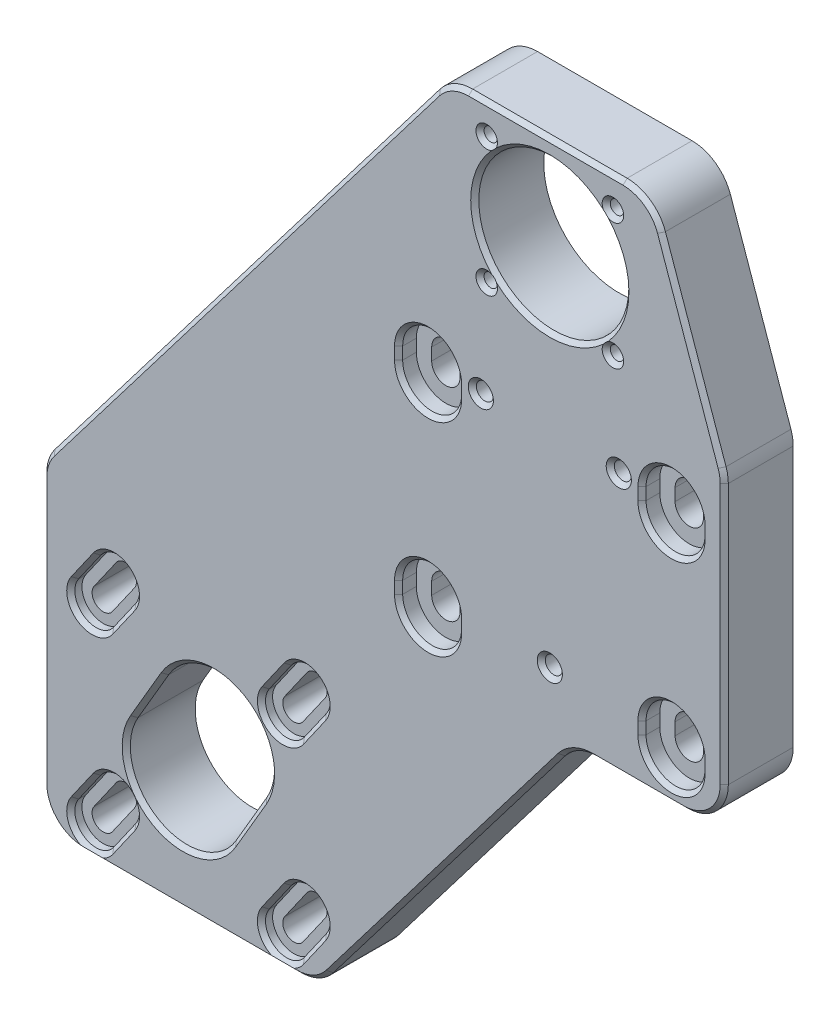
from build123d import *

# Parameters (mm, degrees)
SKETCH1_R                                = 18.5
BOSS_EXTRUDE1_DEPTH                      = 17
CBORE_SLOT_FOR_M6_HEX_HEAD_BOLT1_DEPTH   = 17
CBORE_START                              = 12.62
CBORE_SLOT_FOR_M6_HEX_HEAD_BOLT1_2_DEPTH = 4.38
CBORE_SLOT_FOR_M5_SBHCS2_DEPTH           = 17
CBORE_START_2                            = 14.25
CBORE_SLOT_FOR_M5_SBHCS2_2_DEPTH         = 2.75
F_1_0MM_DOWEL_SLOT1_DEPTH                = 17
M4X0_7_TAPPED_HOLE1_D                    = 3.3
M4X0_7_TAPPED_HOLE1_DEPTH                = 19.008579979
M4X0_7_TAPPED_HOLE1_TIP                  = 0.991420021
CUT_EXTRUDE1_DEPTH                       = 181.430041844
FILLET1_R                                = 10
SKETCH32_R                               = 2.1
CUT_EXTRUDE2_DEPTH                       = 181.430041844
CHAMFER1_SIZE                            = 1


# Read off the part's stored shape, not the designer's step: CBORE SLOT for M6 Hex Head Bolt1, CBORE SLOT for M5 SBHCS2, Ø1.0mm Dowel Slot1
with BuildPart() as part:
    # Sketch1 → Boss-Extrude1 (new body)
    with BuildSketch(Plane.XY):
        Polygon((14.773286703, 129), (-14.773286703, 129), (-24.97132573, 129), (-68.446152342, 72.042287449), (-120, 4.5), (-125, -2.050654366), (-125, -48), (-125, -70.733642247), (-125, -80.733642247), (-28.453270191, -80.733642247), (-28.453270191, -70.733642247), (-28.453270191, -42.871506204), (2.916826433, -1.772574122), (5.796366332, 2), (7.273364905, 2), (43, 2), (43, 78), (25.15845151, 129), (20.15845151, 129), align=None)
        with Locations((0, 106)):
            Circle(SKETCH1_R, mode=Mode.SUBTRACT)
    extrude(amount=BOSS_EXTRUDE1_DEPTH)

    # CBORE SLOT for M6 Hex Head Bolt1 outline → CBORE SLOT for M6 Hex Head Bolt1 (cut)
    with BuildSketch(Plane.XY):
        with BuildLine():
            Line((-26.5, 12.5), (-26.5, 15.5))
            ThreePointArc((-26.5, 15.5), (-30, 19), (-33.5, 15.5))
            Line((-33.5, 15.5), (-33.5, 12.5))
            ThreePointArc((-33.5, 12.5), (-30, 9), (-26.5, 12.5))
        make_face()
        with BuildLine():
            ThreePointArc((-26.5, 65.5), (-30, 69), (-33.5, 65.5))
            Line((-33.5, 65.5), (-33.5, 62.5))
            ThreePointArc((-33.5, 62.5), (-30, 59), (-26.5, 62.5))
            Line((-26.5, 62.5), (-26.5, 65.5))
        make_face()
        with BuildLine():
            ThreePointArc((33.5, 15.5), (30, 19), (26.5, 15.5))
            Line((26.5, 15.5), (26.5, 12.5))
            ThreePointArc((26.5, 12.5), (30, 9), (33.5, 12.5))
            Line((33.5, 12.5), (33.5, 15.5))
        make_face()
        with BuildLine():
            ThreePointArc((33.5, 65.5), (30, 69), (26.5, 65.5))
            Line((26.5, 65.5), (26.5, 62.5))
            ThreePointArc((26.5, 62.5), (30, 59), (33.5, 62.5))
            Line((33.5, 62.5), (33.5, 65.5))
        make_face()
    extrude(amount=CBORE_SLOT_FOR_M6_HEX_HEAD_BOLT1_DEPTH, mode=Mode.SUBTRACT)

    # CBORE SLOT for M6 Hex Head Bolt1 2 outli → CBORE SLOT for M6 Hex Head Bolt1 2 (cut)
    # profile 1 of 4: a face of its own
    with BuildSketch(Plane.XY.offset(CBORE_START)):
        with BuildLine():
            Line((-22.725, 12.5), (-22.725, 15.5))
            ThreePointArc((-22.725, 15.5), (-30, 22.775), (-37.275, 15.5))
            Line((-37.275, 15.5), (-37.275, 12.5))
            ThreePointArc((-37.275, 12.5), (-30, 5.225), (-22.725, 12.5))
        make_face()
        with BuildLine():
            ThreePointArc((-33.5, 15.5), (-30, 19), (-26.5, 15.5))
            Line((-26.5, 15.5), (-26.5, 12.5))
            ThreePointArc((-26.5, 12.5), (-30, 9), (-33.5, 12.5))
            Line((-33.5, 12.5), (-33.5, 15.5))
        make_face(mode=Mode.SUBTRACT)
    # profile 2 of 4: a face of its own
    with BuildSketch(Plane.XY.offset(CBORE_START)):
        with BuildLine():
            ThreePointArc((-22.725, 65.5), (-30, 72.775), (-37.275, 65.5))
            Line((-37.275, 65.5), (-37.275, 62.5))
            ThreePointArc((-37.275, 62.5), (-30, 55.225), (-22.725, 62.5))
            Line((-22.725, 62.5), (-22.725, 65.5))
        make_face()
        with BuildLine():
            Line((-33.5, 62.5), (-33.5, 65.5))
            ThreePointArc((-33.5, 65.5), (-30, 69), (-26.5, 65.5))
            Line((-26.5, 65.5), (-26.5, 62.5))
            ThreePointArc((-26.5, 62.5), (-30, 59), (-33.5, 62.5))
        make_face(mode=Mode.SUBTRACT)
    # profile 3 of 4: a face of its own
    with BuildSketch(Plane.XY.offset(CBORE_START)):
        with BuildLine():
            Line((37.275, 12.5), (37.275, 15.5))
            ThreePointArc((37.275, 15.5), (30, 22.775), (22.725, 15.5))
            Line((22.725, 15.5), (22.725, 12.5))
            ThreePointArc((22.725, 12.5), (30, 5.225), (37.275, 12.5))
        make_face()
        with BuildLine():
            Line((26.5, 12.5), (26.5, 15.5))
            ThreePointArc((26.5, 15.5), (30, 19), (33.5, 15.5))
            Line((33.5, 15.5), (33.5, 12.5))
            ThreePointArc((33.5, 12.5), (30, 9), (26.5, 12.5))
        make_face(mode=Mode.SUBTRACT)
    # profile 4 of 4: a face of its own
    with BuildSketch(Plane.XY.offset(CBORE_START)):
        with BuildLine():
            ThreePointArc((37.275, 65.5), (30, 72.775), (22.725, 65.5))
            Line((22.725, 65.5), (22.725, 62.5))
            ThreePointArc((22.725, 62.5), (30, 55.225), (37.275, 62.5))
            Line((37.275, 62.5), (37.275, 65.5))
        make_face()
        with BuildLine():
            Line((26.5, 62.5), (26.5, 65.5))
            ThreePointArc((26.5, 65.5), (30, 69), (33.5, 65.5))
            Line((33.5, 65.5), (33.5, 62.5))
            ThreePointArc((33.5, 62.5), (30, 59), (26.5, 62.5))
        make_face(mode=Mode.SUBTRACT)
    extrude(amount=CBORE_SLOT_FOR_M6_HEX_HEAD_BOLT1_2_DEPTH, mode=Mode.SUBTRACT)

    # CBORE SLOT for M5 SBHCS2 outline → CBORE SLOT for M5 SBHCS2 (cut)
    with BuildSketch(Plane.XY):
        with BuildLine():
            ThreePointArc((-58.130828226, -20.926963557), (-58.806161147, -17.096960235), (-62.636164469, -17.772293157))
            Line((-62.636164469, -17.772293157), (-68.085140615, -25.554237577))
            ThreePointArc((-68.085140615, -25.554237577), (-67.409807693, -29.384240899), (-63.579804371, -28.708907977))
            Line((-63.579804371, -28.708907977), (-58.130828226, -20.926963557))
        make_face()
        with BuildLine():
            Line((-63.579804371, -75.708907977), (-58.130828226, -67.926963557))
            ThreePointArc((-58.130828226, -67.926963557), (-58.806161147, -64.096960235), (-62.636164469, -64.772293157))
            Line((-62.636164469, -64.772293157), (-68.085140615, -72.554237577))
            ThreePointArc((-68.085140615, -72.554237577), (-67.409807693, -76.384240899), (-63.579804371, -75.708907977))
        make_face()
        with BuildLine():
            ThreePointArc((-105.130828226, -67.926963557), (-105.806161147, -64.096960235), (-109.636164469, -64.772293157))
            Line((-109.636164469, -64.772293157), (-115.085140615, -72.554237577))
            ThreePointArc((-115.085140615, -72.554237577), (-114.409807693, -76.384240899), (-110.579804371, -75.708907977))
            Line((-110.579804371, -75.708907977), (-105.130828226, -67.926963557))
        make_face()
        with BuildLine():
            ThreePointArc((-105.130828226, -20.926963557), (-105.806161147, -17.096960235), (-109.636164469, -17.772293157))
            Line((-109.636164469, -17.772293157), (-115.085140615, -25.554237577))
            ThreePointArc((-115.085140615, -25.554237577), (-114.409807693, -29.384240899), (-110.579804371, -28.708907977))
            Line((-110.579804371, -28.708907977), (-105.130828226, -20.926963557))
        make_face()
    extrude(amount=CBORE_SLOT_FOR_M5_SBHCS2_DEPTH, mode=Mode.SUBTRACT)

    # CBORE SLOT for M5 SBHCS2 2 outline → CBORE SLOT for M5 SBHCS2 2 (cut)
    # profile 1 of 4: a face of its own
    with BuildSketch(Plane.XY.offset(CBORE_START_2)):
        with BuildLine():
            Line((-61.53192426, -30.142849068), (-56.082948115, -22.360904647))
            ThreePointArc((-56.082948115, -22.360904647), (-57.372220057, -15.049080124), (-64.68404458, -16.338352066))
            Line((-64.68404458, -16.338352066), (-70.133020725, -24.120296486))
            ThreePointArc((-70.133020725, -24.120296486), (-68.843748784, -31.43212101), (-61.53192426, -30.142849068))
        make_face()
        with BuildLine():
            Line((-68.085140615, -25.554237577), (-62.636164469, -17.772293157))
            ThreePointArc((-62.636164469, -17.772293157), (-58.806161147, -17.096960235), (-58.130828226, -20.926963557))
            Line((-58.130828226, -20.926963557), (-63.579804371, -28.708907977))
            ThreePointArc((-63.579804371, -28.708907977), (-67.409807693, -29.384240899), (-68.085140615, -25.554237577))
        make_face(mode=Mode.SUBTRACT)
    # profile 2 of 4: a face of its own
    with BuildSketch(Plane.XY.offset(CBORE_START_2)):
        with BuildLine():
            Line((-61.53192426, -77.142849068), (-56.082948115, -69.360904647))
            ThreePointArc((-56.082948115, -69.360904647), (-57.372220057, -62.049080124), (-64.68404458, -63.338352066))
            Line((-64.68404458, -63.338352066), (-70.133020725, -71.120296486))
            ThreePointArc((-70.133020725, -71.120296486), (-68.843748784, -78.43212101), (-61.53192426, -77.142849068))
        make_face()
        with BuildLine():
            ThreePointArc((-62.636164469, -64.772293157), (-58.806161147, -64.096960235), (-58.130828226, -67.926963557))
            Line((-58.130828226, -67.926963557), (-63.579804371, -75.708907977))
            ThreePointArc((-63.579804371, -75.708907977), (-67.409807693, -76.384240899), (-68.085140615, -72.554237577))
            Line((-68.085140615, -72.554237577), (-62.636164469, -64.772293157))
        make_face(mode=Mode.SUBTRACT)
    # profile 3 of 4: a face of its own
    with BuildSketch(Plane.XY.offset(CBORE_START_2)):
        with BuildLine():
            Line((-108.53192426, -77.142849068), (-103.082948115, -69.360904647))
            ThreePointArc((-103.082948115, -69.360904647), (-104.372220057, -62.049080124), (-111.68404458, -63.338352066))
            Line((-111.68404458, -63.338352066), (-117.133020725, -71.120296486))
            ThreePointArc((-117.133020725, -71.120296486), (-115.843748784, -78.43212101), (-108.53192426, -77.142849068))
        make_face()
        with BuildLine():
            Line((-115.085140615, -72.554237577), (-109.636164469, -64.772293157))
            ThreePointArc((-109.636164469, -64.772293157), (-105.806161147, -64.096960235), (-105.130828226, -67.926963557))
            Line((-105.130828226, -67.926963557), (-110.579804371, -75.708907977))
            ThreePointArc((-110.579804371, -75.708907977), (-114.409807693, -76.384240899), (-115.085140615, -72.554237577))
        make_face(mode=Mode.SUBTRACT)
    # profile 4 of 4: a face of its own
    with BuildSketch(Plane.XY.offset(CBORE_START_2)):
        with BuildLine():
            Line((-108.53192426, -30.142849068), (-103.082948115, -22.360904647))
            ThreePointArc((-103.082948115, -22.360904647), (-104.372220057, -15.049080124), (-111.68404458, -16.338352066))
            Line((-111.68404458, -16.338352066), (-117.133020725, -24.120296486))
            ThreePointArc((-117.133020725, -24.120296486), (-115.843748784, -31.43212101), (-108.53192426, -30.142849068))
        make_face()
        with BuildLine():
            Line((-115.085140615, -25.554237577), (-109.636164469, -17.772293157))
            ThreePointArc((-109.636164469, -17.772293157), (-105.806161147, -17.096960235), (-105.130828226, -20.926963557))
            Line((-105.130828226, -20.926963557), (-110.579804371, -28.708907977))
            ThreePointArc((-110.579804371, -28.708907977), (-114.409807693, -29.384240899), (-115.085140615, -25.554237577))
        make_face(mode=Mode.SUBTRACT)
    extrude(amount=CBORE_SLOT_FOR_M5_SBHCS2_2_DEPTH, mode=Mode.SUBTRACT)

    # Ø1.0mm Dowel Slot1 outline → Ø1.0mm Dowel Slot1 (cut)
    with BuildSketch(Plane.XY):
        with BuildLine():
            Line((-78.324292633, -60.568838609), (-70.755748602, -47.618273322))
            ThreePointArc((-70.755748602, -47.618273322), (-75.77896844, -28.467104625), (-94.930137137, -33.490324464))
            Line((-94.930137137, -33.490324464), (-102.498681169, -46.440889751))
            ThreePointArc((-102.498681169, -46.440889751), (-97.47546133, -65.592058448), (-78.324292633, -60.568838609))
        make_face()
    extrude(amount=F_1_0MM_DOWEL_SLOT1_DEPTH, mode=Mode.SUBTRACT)

    # M4x0.7 Tapped Hole1
    with Locations(Plane.XY.offset(17)):
        with Locations((-15.556349182, 90.443650818), (-15.556349182, 121.556349182), (15.556349182, 121.556349182), (15.556349182, 90.443650818)):
            Hole(M4X0_7_TAPPED_HOLE1_D / 2, depth=M4X0_7_TAPPED_HOLE1_DEPTH)
            with Locations((0, 0, -(M4X0_7_TAPPED_HOLE1_DEPTH + M4X0_7_TAPPED_HOLE1_TIP / 2))):  # 118° drill point
                Cone(0, M4X0_7_TAPPED_HOLE1_D / 2, M4X0_7_TAPPED_HOLE1_TIP, mode=Mode.SUBTRACT)

    # Sketch31 → Cut-Extrude1 (cut, through all)
    with BuildSketch(Plane.XY.offset(17)):
        Polygon((-28.453270191, -42.871506204), (-57.352776964, -80.733642247), (-28.453270191, -80.733642247), align=None)
    extrude(amount=-CUT_EXTRUDE1_DEPTH, mode=Mode.SUBTRACT)

    # Fillet1
    fillet1_edges = [part.edges().sort_by_distance(p)[0] for p in [
        (-24.97132573, 129, 8.5),
        (25.15845151, 129, 8.5),
        (43, 78, 8.5),
        (43, 2, 8.5),
        (5.796366332, 2, 8.5),
        (-125, -80.733642247, 8.5),
        (-125, -2.050654366, 8.5),
        (-57.352776964, -80.733642247, 8.5),
    ]]
    fillet(fillet1_edges, radius=FILLET1_R)

    # Sketch32 → Cut-Extrude2 (cut, through all)
    with BuildSketch(Plane.XY.offset(17)):
        with Locations((0, 16.052502004)):
            Circle(SKETCH32_R)
        with Locations((-17, 66)):
            Circle(SKETCH32_R)
        with Locations((17, 66)):
            Circle(SKETCH32_R)
    extrude(amount=-CUT_EXTRUDE2_DEPTH, mode=Mode.SUBTRACT)

    # Chamfer1
    # the kernel refuses this chamfer: 1 mm, written as the material it takes off along each edge
    with BuildSketch(Plane(origin=(-22.725, 62.5, 17), x_dir=(0.9996219169112968, 0, 0.027495876610585647), z_dir=(0, 1, 0)), Plane(origin=(-37.275, 65.5, 17), x_dir=(-0.9996219169112968, 0, 0.02749587661058555), z_dir=(0, -1, 0)), Plane(origin=(-22.725, 12.5, 17), x_dir=(0.9996219169112968, 0, 0.027495876610585647), z_dir=(0, 1, 0)), Plane(origin=(-37.275, 15.5, 17), x_dir=(-0.9996219169112968, 0, 0.02749587661058555), z_dir=(0, -1, 0)), Plane(origin=(37.275, 12.5, 17), x_dir=(0.9996219169112968, 0, 0.02749587661058555), z_dir=(0, 1, 0)), Plane(origin=(22.725, 15.5, 17), x_dir=(-0.9996219169112968, 0, 0.027495876610585647), z_dir=(0, -1, 0)), Plane(origin=(37.275, 62.5, 17), x_dir=(0.9996219169112968, 0, 0.02749587661058555), z_dir=(0, 1, 0)), Plane(origin=(22.725, 65.5, 17), x_dir=(-0.9996219169112968, 0, 0.027495876610585647), z_dir=(0, -1, 0))) as chamfer1_piece_1:
        Polygon((CHAMFER1_SIZE * 0.999621916911, CHAMFER1_SIZE * 0.0274958766106), (-CHAMFER1_SIZE * 0.0274958766106, CHAMFER1_SIZE * 0.999621916911), (0, 0), align=None)
    extrude(amount=3, mode=Mode.SUBTRACT)
    with BuildSketch(Plane(origin=(-30, 65.5, 17), x_dir=(1, 0, 0), z_dir=(0, -1, 0))) as chamfer1_piece_2:
        Polygon((7.275 + CHAMFER1_SIZE, 0), (7.275, -CHAMFER1_SIZE), (7.275, 0), align=None)
    revolve(axis=Axis((-30, 65.5, 17), (0, 0, 1)), revolution_arc=180, mode=Mode.SUBTRACT)
    with BuildSketch(Plane(origin=(-30, 62.5, 17), x_dir=(-1, 0, 0), z_dir=(0, 1, 0))) as chamfer1_piece_3:
        Polygon((7.275 + CHAMFER1_SIZE, 0), (7.275, -CHAMFER1_SIZE), (7.275, 0), align=None)
    revolve(axis=Axis((-30, 62.5, 17), (0, 0, 1)), revolution_arc=180, mode=Mode.SUBTRACT)
    with BuildSketch(Plane(origin=(-61.53192426, -30.142849068, 17), x_dir=(0.8188423367793413, -0.5733595767641482, 0.027495876610585713), z_dir=(0.5735764363147976, 0.8191520443143734, 0)), Plane(origin=(-61.53192426, -77.142849068, 17), x_dir=(0.8188423367793416, -0.5733595767641478, 0.027495876610585657), z_dir=(0.5735764363147972, 0.8191520443143736, 0)), Plane(origin=(-108.53192426, -77.142849068, 17), x_dir=(0.8188423367793413, -0.5733595767641484, 0.02749587661058535), z_dir=(0.5735764363147977, 0.8191520443143733, 0)), Plane(origin=(-108.53192426, -30.142849068, 17), x_dir=(0.818842336779341, -0.5733595767641487, 0.027495876610585404), z_dir=(0.573576436314798, 0.8191520443143729, 0))) as chamfer1_piece_4:
        Polygon((CHAMFER1_SIZE * 0.999621916911, CHAMFER1_SIZE * 0.0274958766106), (-CHAMFER1_SIZE * 0.0274958766106, CHAMFER1_SIZE * 0.999621916911), (0, 0), align=None)
    extrude(amount=9.5, mode=Mode.SUBTRACT)
    with BuildSketch(Plane(origin=(-60.383496347, -19.349628356, 17), x_dir=(0.819152044318609, -0.5735764363087482, 0), z_dir=(-0.5735764363087482, -0.819152044318609, 0))) as chamfer1_piece_5:
        Polygon((5.25 + CHAMFER1_SIZE, 0), (5.25, -CHAMFER1_SIZE), (5.25, 0), align=None)
    revolve(axis=Axis((-60.383496347, -19.349628356, 17), (0, 0, 1)), revolution_arc=180, mode=Mode.SUBTRACT)
    with BuildSketch(Plane(origin=(-65.832472493, -27.131572778, 17), x_dir=(-0.8191520441977824, 0.5735764364813065, 0), z_dir=(0.5735764364813065, 0.8191520441977824, 0))) as chamfer1_piece_6:
        Polygon((5.25 + CHAMFER1_SIZE, 0), (5.25, -CHAMFER1_SIZE), (5.25, 0), align=None)
    revolve(axis=Axis((-65.832472493, -27.131572778, 17), (0, 0, 1)), revolution_arc=180.000000015, mode=Mode.SUBTRACT)
    with BuildSketch(Plane(origin=(-64.68404458, -16.338352066, 17), x_dir=(-0.8188423367447243, 0.5733595768135863, 0.02749587661058544), z_dir=(-0.5735764363642545, -0.8191520442797433, 0)), Plane(origin=(-64.68404458, -63.338352066, 17), x_dir=(-0.8188423367447243, 0.5733595768135864, 0.02749587661058555), z_dir=(-0.5735764363642545, -0.8191520442797433, 0)), Plane(origin=(-111.68404458, -63.338352066, 17), x_dir=(-0.8188423367447243, 0.5733595768135864, 0.02749587661058555), z_dir=(-0.5735764363642545, -0.8191520442797433, 0)), Plane(origin=(-111.68404458, -16.338352066, 17), x_dir=(-0.8188423367447243, 0.5733595768135863, 0.02749587661058544), z_dir=(-0.5735764363642545, -0.8191520442797433, 0))) as chamfer1_piece_7:
        Polygon((CHAMFER1_SIZE * 0.999621916911, CHAMFER1_SIZE * 0.0274958766106), (-CHAMFER1_SIZE * 0.0274958766106, CHAMFER1_SIZE * 0.999621916911), (0, 0), align=None)
    extrude(amount=9.499999999, mode=Mode.SUBTRACT)
    with BuildSketch(Plane(origin=(-60.383496347, -66.349628356, 17), x_dir=(0.8191520443186088, -0.5735764363087487, 0), z_dir=(-0.5735764363087487, -0.8191520443186088, 0))) as chamfer1_piece_8:
        Polygon((5.25 + CHAMFER1_SIZE, 0), (5.25, -CHAMFER1_SIZE), (5.25, 0), align=None)
    revolve(axis=Axis((-60.383496347, -66.349628356, 17), (0, 0, 1)), revolution_arc=180, mode=Mode.SUBTRACT)
    with BuildSketch(Plane(origin=(-65.832472493, -74.131572778, 17), x_dir=(-0.8191520441977828, 0.5735764364813061, 0), z_dir=(0.5735764364813061, 0.8191520441977828, 0))) as chamfer1_piece_9:
        Polygon((5.25 + CHAMFER1_SIZE, 0), (5.25, -CHAMFER1_SIZE), (5.25, 0), align=None)
    revolve(axis=Axis((-65.832472493, -74.131572778, 17), (0, 0, 1)), revolution_arc=180.000000015, mode=Mode.SUBTRACT)
    with BuildSketch(Plane(origin=(-107.383496348, -66.349628357, 17), x_dir=(0.8191520443186114, -0.573576436308745, 0), z_dir=(-0.573576436308745, -0.8191520443186114, 0))) as chamfer1_piece_10:
        Polygon((5.25 + CHAMFER1_SIZE, 0), (5.25, -CHAMFER1_SIZE), (5.25, 0), align=None)
    revolve(axis=Axis((-107.383496348, -66.349628357, 17), (0, 0, 1)), revolution_arc=180, mode=Mode.SUBTRACT)
    with BuildSketch(Plane(origin=(-112.832472493, -74.131572778, 17), x_dir=(-0.8191520441977828, 0.5735764364813061, 0), z_dir=(0.5735764364813061, 0.8191520441977828, 0))) as chamfer1_piece_11:
        Polygon((5.25 + CHAMFER1_SIZE, 0), (5.25, -CHAMFER1_SIZE), (5.25, 0), align=None)
    revolve(axis=Axis((-112.832472493, -74.131572778, 17), (0, 0, 1)), revolution_arc=180.000000015, mode=Mode.SUBTRACT)
    with BuildSketch(Plane(origin=(-107.383496348, -19.349628357, 17), x_dir=(0.8191520443186114, -0.573576436308745, 0), z_dir=(-0.573576436308745, -0.8191520443186114, 0))) as chamfer1_piece_12:
        Polygon((5.25 + CHAMFER1_SIZE, 0), (5.25, -CHAMFER1_SIZE), (5.25, 0), align=None)
    revolve(axis=Axis((-107.383496348, -19.349628357, 17), (0, 0, 1)), revolution_arc=180, mode=Mode.SUBTRACT)
    with BuildSketch(Plane(origin=(-112.832472493, -27.131572778, 17), x_dir=(-0.8191520441977824, 0.5735764364813065, 0), z_dir=(0.5735764364813065, 0.8191520441977824, 0))) as chamfer1_piece_13:
        Polygon((5.25 + CHAMFER1_SIZE, 0), (5.25, -CHAMFER1_SIZE), (5.25, 0), align=None)
    revolve(axis=Axis((-112.832472493, -27.131572778, 17), (0, 0, 1)), revolution_arc=180.000000015, mode=Mode.SUBTRACT)
    with BuildSketch(Plane(origin=(-78.324292633, -60.568838609, 17), x_dir=(0.8630445931478193, -0.5043788328307707, 0.027495876610585564), z_dir=(0.504569602064385, 0.8633710191294286, 0))) as chamfer1_piece_14:
        Polygon((CHAMFER1_SIZE * 0.999621916911, CHAMFER1_SIZE * 0.0274958766106), (-CHAMFER1_SIZE * 0.0274958766106, CHAMFER1_SIZE * 0.999621916911), (0, 0), align=None)
    extrude(amount=15, mode=Mode.SUBTRACT)
    with BuildSketch(Plane(origin=(-82.842942869, -40.554298892, 17), x_dir=(0.8633710190960359, -0.5045696021215237, 0), z_dir=(-0.5045696021215237, -0.8633710190960359, 0))) as chamfer1_piece_15:
        Polygon((14 + CHAMFER1_SIZE, 0), (14, -CHAMFER1_SIZE), (14, 0), align=None)
    revolve(axis=Axis((-82.842942869, -40.554298892, 17), (0, 0, 1)), revolution_arc=180.000000006, mode=Mode.SUBTRACT)
    with BuildSketch(Plane(origin=(-90.411486901, -53.50486418, 17), x_dir=(-0.8633710191297784, 0.5045696020637864, 0), z_dir=(0.5045696020637864, 0.8633710191297784, 0))) as chamfer1_piece_16:
        Polygon((14 + CHAMFER1_SIZE, 0), (14, -CHAMFER1_SIZE), (14, 0), align=None)
    revolve(axis=Axis((-90.411486901, -53.50486418, 17), (0, 0, 1)), revolution_arc=180, mode=Mode.SUBTRACT)
    with BuildSketch(Plane(origin=(-94.930137137, -33.490324464, 17), x_dir=(-0.8630445931187887, 0.5043788328804453, 0.02749587661058557), z_dir=(-0.5045696021140783, -0.863371019100387, 0))) as chamfer1_piece_17:
        Polygon((CHAMFER1_SIZE * 0.999621916911, CHAMFER1_SIZE * 0.0274958766106), (-CHAMFER1_SIZE * 0.0274958766106, CHAMFER1_SIZE * 0.999621916911), (0, 0), align=None)
    extrude(amount=15.000000001, mode=Mode.SUBTRACT)
    with BuildSketch(Plane(origin=(15.556349182, 90.443650818, 17), x_dir=(-1, 0, 0), z_dir=(0, -1, 0))) as chamfer1_piece_18:
        Polygon((1.65 + CHAMFER1_SIZE, 0), (1.65, CHAMFER1_SIZE), (1.65, 0), align=None)
    revolve(axis=Axis((15.556349182, 90.443650818, 17), (0, 0, -1)), mode=Mode.SUBTRACT)
    with BuildSketch(Plane(origin=(15.556349182, 121.556349182, 17), x_dir=(-1, 0, 0), z_dir=(0, -1, 0))) as chamfer1_piece_19:
        Polygon((1.65 + CHAMFER1_SIZE, 0), (1.65, CHAMFER1_SIZE), (1.65, 0), align=None)
    revolve(axis=Axis((15.556349182, 121.556349182, 17), (0, 0, -1)), mode=Mode.SUBTRACT)
    with BuildSketch(Plane(origin=(-15.556349182, 121.556349182, 17), x_dir=(-1, 0, 0), z_dir=(0, -1, 0))) as chamfer1_piece_20:
        Polygon((1.65 + CHAMFER1_SIZE, 0), (1.65, CHAMFER1_SIZE), (1.65, 0), align=None)
    revolve(axis=Axis((-15.556349182, 121.556349182, 17), (0, 0, -1)), mode=Mode.SUBTRACT)
    with BuildSketch(Plane(origin=(-15.556349182, 90.443650818, 17), x_dir=(-1, 0, 0), z_dir=(0, -1, 0))) as chamfer1_piece_21:
        Polygon((1.65 + CHAMFER1_SIZE, 0), (1.65, CHAMFER1_SIZE), (1.65, 0), align=None)
    revolve(axis=Axis((-15.556349182, 90.443650818, 17), (0, 0, -1)), mode=Mode.SUBTRACT)
    with BuildSketch(Plane(origin=(-125, -70.733642247, 17), x_dir=(0.9996219169112968, 0, 0.02749587661058574), z_dir=(0, 1, 0))) as chamfer1_piece_22:
        Polygon((CHAMFER1_SIZE * 0.999621916911, CHAMFER1_SIZE * 0.0274958766106), (-CHAMFER1_SIZE * 0.0274958766106, CHAMFER1_SIZE * 0.999621916911), (0, 0), align=None)
    extrude(amount=65.302661667, mode=Mode.SUBTRACT)
    with BuildSketch(Plane(origin=(-122.949034653, 0.636378655, 17), x_dir=(0.7946029257209413, -0.6065065269270692, 0.027495876610585765), z_dir=(0.6067359235190606, 0.7949034652783147, 0))) as chamfer1_piece_23:
        Polygon((CHAMFER1_SIZE * 0.999621916911, CHAMFER1_SIZE * 0.0274958766106), (-CHAMFER1_SIZE * 0.0274958766106, CHAMFER1_SIZE * 0.999621916911), (0, 0), align=None)
    extrude(amount=156.535964447, mode=Mode.SUBTRACT)
    with BuildSketch(Plane(origin=(-115, -80.733642247, 17), x_dir=(0, 0.9996219169112968, 0.02749587661058574), z_dir=(1, 0, 0))) as chamfer1_piece_24:
        Polygon((CHAMFER1_SIZE * 0.999621916911, -CHAMFER1_SIZE * 0.0274958766106), (-CHAMFER1_SIZE * 0.0274958766106, -CHAMFER1_SIZE * 0.999621916911), (0, 0), align=None)
    extrude(amount=52.699904354, mode=Mode.SUBTRACT)
    with BuildSketch(Plane(origin=(2.794650362, -1.932640765, 17), x_dir=(0.021856567598623956, -0.01668273608829322, -0.9996219169112965), z_dir=(-0.6067359235190605, -0.7949034652783148, 0))) as chamfer1_piece_25:
        Polygon((CHAMFER1_SIZE * 0.999621916911, -CHAMFER1_SIZE * 0.0274958766106), (-CHAMFER1_SIZE * 0.0274958766106, -CHAMFER1_SIZE * 0.999621916911), (0, 0), align=None)
    extrude(amount=94.185475328, mode=Mode.SUBTRACT)
    with BuildSketch(Plane(origin=(33, 2, 17), x_dir=(0, 0.9996219169112968, 0.027495876610585623), z_dir=(-1, 0, 0))) as chamfer1_piece_26:
        Polygon((CHAMFER1_SIZE * 0.999621916911, CHAMFER1_SIZE * 0.0274958766106), (-CHAMFER1_SIZE * 0.0274958766106, CHAMFER1_SIZE * 0.999621916911), (0, 0), align=None)
    extrude(amount=22.256314986, mode=Mode.SUBTRACT)
    with BuildSketch(Plane(origin=(43, 12, 17), x_dir=(-0.9996219169112968, 0, 0.02749587661058574), z_dir=(0, 1, 0))) as chamfer1_piece_27:
        Polygon((CHAMFER1_SIZE * 0.999621916911, -CHAMFER1_SIZE * 0.0274958766106), (-CHAMFER1_SIZE * 0.0274958766106, -CHAMFER1_SIZE * 0.999621916911), (0, 0), align=None)
    extrude(amount=64.301302218, mode=Mode.SUBTRACT)
    with BuildSketch(Plane(origin=(42.439071186, 79.603412929, 17), x_dir=(-0.9435502432675679, -0.3300862238857129, 0.027495876610585814), z_dir=(-0.3302110711074012, 0.9439071185864121, 0))) as chamfer1_piece_28:
        Polygon((CHAMFER1_SIZE * 0.999621916911, -CHAMFER1_SIZE * 0.0274958766106), (-CHAMFER1_SIZE * 0.0274958766106, -CHAMFER1_SIZE * 0.999621916911), (0, 0), align=None)
    extrude(amount=45.236122222, mode=Mode.SUBTRACT)
    with BuildSketch(Plane(origin=(-20.024007047, 129, 17), x_dir=(0, -0.9996219169112968, 0.02749587661058574), z_dir=(1, 0, 0))) as chamfer1_piece_29:
        Polygon((CHAMFER1_SIZE * 0.999621916911, CHAMFER1_SIZE * 0.0274958766106), (-CHAMFER1_SIZE * 0.0274958766106, CHAMFER1_SIZE * 0.999621916911), (0, 0), align=None)
    extrude(amount=38.086538676, mode=Mode.SUBTRACT)
    with BuildSketch(Plane(origin=(-115, -70.733642247, 17), x_dir=(-1, 0, 0), z_dir=(0, 1, 0))) as chamfer1_piece_30:
        Polygon((10 - CHAMFER1_SIZE, 0), (10, -CHAMFER1_SIZE), (10, 0), align=None)
    revolve(axis=Axis((-115, -70.733642247, 17), (0, 0, 1)), revolution_arc=90, mode=Mode.SUBTRACT)
    with BuildSketch(Plane(origin=(-62.300095646, -70.733642247, 17), x_dir=(0.7949034652783158, -0.606735923519059, 0), z_dir=(0.606735923519059, 0.7949034652783158, 0))) as chamfer1_piece_31:
        Polygon((10, CHAMFER1_SIZE), (10 - CHAMFER1_SIZE, 0), (10, 0), align=None)
    revolve(axis=Axis((-62.300095646, -70.733642247, 17), (0, 0, -1)), revolution_arc=52.64613865, mode=Mode.SUBTRACT)
    with BuildSketch(Plane(origin=(33, 12, 17), x_dir=(1, 0, 0), z_dir=(0, 1, 0))) as chamfer1_piece_32:
        Polygon((10 - CHAMFER1_SIZE, 0), (10, CHAMFER1_SIZE), (10, 0), align=None)
    revolve(axis=Axis((33, 12, 17), (0, 0, -1)), revolution_arc=90, mode=Mode.SUBTRACT)
    with BuildSketch(Plane(origin=(33, 76.301302218, 17), x_dir=(0.9439071185864123, 0.3302110711074008, 0), z_dir=(-0.3302110711074008, 0.9439071185864123, 0))) as chamfer1_piece_33:
        Polygon((10 - CHAMFER1_SIZE, 0), (10, CHAMFER1_SIZE), (10, 0), align=None)
    revolve(axis=Axis((33, 76.301302218, 17), (0, 0, -1)), revolution_arc=19.281587145, mode=Mode.SUBTRACT)
    with BuildSketch(Plane(origin=(18.062531628, 119, 17), x_dir=(0, 1, 0), z_dir=(-1, 0, 0))) as chamfer1_piece_34:
        Polygon((10 - CHAMFER1_SIZE, 0), (10, CHAMFER1_SIZE), (10, 0), align=None)
    revolve(axis=Axis((18.062531628, 119, 17), (0, 0, -1)), revolution_arc=70.718412855, mode=Mode.SUBTRACT)
    with BuildSketch(Plane(origin=(-20.024007047, 119, 17), x_dir=(-0.7949034652783145, 0.6067359235190608, 0), z_dir=(-0.6067359235190608, -0.7949034652783145, 0))) as chamfer1_piece_35:
        Polygon((10 - CHAMFER1_SIZE, 0), (10, CHAMFER1_SIZE), (10, 0), align=None)
    revolve(axis=Axis((-20.024007047, 119, 17), (0, 0, -1)), revolution_arc=52.64613865, mode=Mode.SUBTRACT)
    with BuildSketch(Plane(origin=(-115, -5.43098058, 17), x_dir=(-1, 0, 0), z_dir=(0, -1, 0))) as chamfer1_piece_36:
        Polygon((10 - CHAMFER1_SIZE, 0), (10, CHAMFER1_SIZE), (10, 0), align=None)
    revolve(axis=Axis((-115, -5.43098058, 17), (0, 0, -1)), revolution_arc=37.35386135, mode=Mode.SUBTRACT)
    with BuildSketch(Plane(origin=(10.743685014, -8, 17), x_dir=(-0.7949034652783153, 0.6067359235190596, 0), z_dir=(-0.6067359235190596, -0.7949034652783153, 0))) as chamfer1_piece_37:
        Polygon((10, CHAMFER1_SIZE), (10 + CHAMFER1_SIZE, 0), (10, 0), align=None)
    revolve(axis=Axis((10.743685014, -8, 17), (0, 0, -1)), revolution_arc=52.64613865, mode=Mode.SUBTRACT)
    with BuildSketch(Plane(origin=(0, 16.052502004, 17), x_dir=(1, 0, 0), z_dir=(0, -1, 0))) as chamfer1_piece_38:
        Polygon((2.1 + CHAMFER1_SIZE, 0), (2.1, -CHAMFER1_SIZE), (2.1, 0), align=None)
    revolve(axis=Axis((0, 16.052502004, 17), (0, 0, 1)), mode=Mode.SUBTRACT)
    with BuildSketch(Plane(origin=(-17, 66, 17), x_dir=(1, 0, 0), z_dir=(0, -1, 0))) as chamfer1_piece_39:
        Polygon((2.1 + CHAMFER1_SIZE, 0), (2.1, -CHAMFER1_SIZE), (2.1, 0), align=None)
    revolve(axis=Axis((-17, 66, 17), (0, 0, 1)), mode=Mode.SUBTRACT)
    with BuildSketch(Plane(origin=(17, 66, 17), x_dir=(1, 0, 0), z_dir=(0, -1, 0))) as chamfer1_piece_40:
        Polygon((2.1 + CHAMFER1_SIZE, 0), (2.1, -CHAMFER1_SIZE), (2.1, 0), align=None)
    revolve(axis=Axis((17, 66, 17), (0, 0, 1)), mode=Mode.SUBTRACT)
    with BuildSketch(Plane(origin=(-30, 15.5, 17), x_dir=(1, 0, 0), z_dir=(0, -1, 0))) as chamfer1_piece_41:
        Polygon((7.275 + CHAMFER1_SIZE, 0), (7.275, -CHAMFER1_SIZE), (7.275, 0), align=None)
    revolve(axis=Axis((-30, 15.5, 17), (0, 0, 1)), revolution_arc=180, mode=Mode.SUBTRACT)
    with BuildSketch(Plane(origin=(-30, 12.5, 17), x_dir=(-1, 0, 0), z_dir=(0, 1, 0))) as chamfer1_piece_42:
        Polygon((7.275 + CHAMFER1_SIZE, 0), (7.275, -CHAMFER1_SIZE), (7.275, 0), align=None)
    revolve(axis=Axis((-30, 12.5, 17), (0, 0, 1)), revolution_arc=180, mode=Mode.SUBTRACT)
    with BuildSketch(Plane(origin=(0, 106, 17), x_dir=(1, 0, 0), z_dir=(0, -1, 0))) as chamfer1_piece_43:
        Polygon((18.5 + CHAMFER1_SIZE, 0), (18.5, -CHAMFER1_SIZE), (18.5, 0), align=None)
    revolve(axis=Axis((0, 106, 17), (0, 0, 1)), mode=Mode.SUBTRACT)
    with BuildSketch(Plane(origin=(30, 15.5, 17), x_dir=(1, 0, 0), z_dir=(0, -1, 0))) as chamfer1_piece_44:
        Polygon((7.275 + CHAMFER1_SIZE, 0), (7.275, -CHAMFER1_SIZE), (7.275, 0), align=None)
    revolve(axis=Axis((30, 15.5, 17), (0, 0, 1)), revolution_arc=180, mode=Mode.SUBTRACT)
    with BuildSketch(Plane(origin=(30, 12.5, 17), x_dir=(-1, 0, 0), z_dir=(0, 1, 0))) as chamfer1_piece_45:
        Polygon((7.275 + CHAMFER1_SIZE, 0), (7.275, -CHAMFER1_SIZE), (7.275, 0), align=None)
    revolve(axis=Axis((30, 12.5, 17), (0, 0, 1)), revolution_arc=180, mode=Mode.SUBTRACT)
    with BuildSketch(Plane(origin=(30, 65.5, 17), x_dir=(1, 0, 0), z_dir=(0, -1, 0))) as chamfer1_piece_46:
        Polygon((7.275 + CHAMFER1_SIZE, 0), (7.275, -CHAMFER1_SIZE), (7.275, 0), align=None)
    revolve(axis=Axis((30, 65.5, 17), (0, 0, 1)), revolution_arc=180, mode=Mode.SUBTRACT)
    with BuildSketch(Plane(origin=(30, 62.5, 17), x_dir=(-1, 0, 0), z_dir=(0, 1, 0))) as chamfer1_piece_47:
        Polygon((7.275 + CHAMFER1_SIZE, 0), (7.275, -CHAMFER1_SIZE), (7.275, 0), align=None)
    revolve(axis=Axis((30, 62.5, 17), (0, 0, 1)), revolution_arc=180, mode=Mode.SUBTRACT)


solid = part.part
